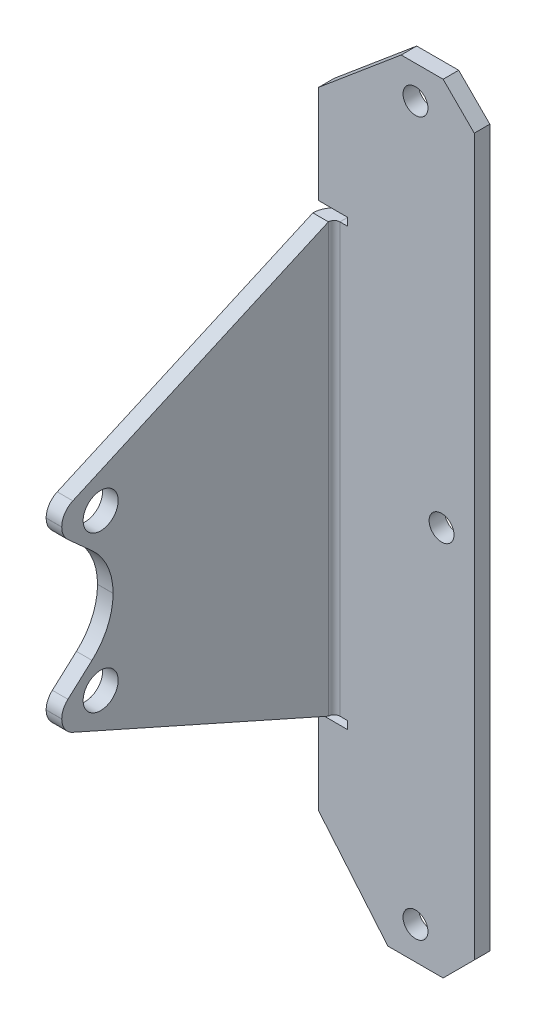
from build123d import *
from OCP.BRepFilletAPI import BRepFilletAPI_MakeChamfer

# Parameters (mm, degrees)
SKETCH1_W             = 100
SKETCH1_H             = 20
SKETCH1_R             = 1.6
BASE_FLANGE2_DEPTH    = 2
MITER_START           = 21.5
MITER_FLANGE1_DEPTH   = 57
MITER_FLANGE1_2_DEPTH = 1
MITER_START_2         = 77.5
MITER_FLANGE1_3_DEPTH = 1
MITER_START_3         = 22.5
MITER_FLANGE1_4_DEPTH = 55
CUT_EXTRUDE2_DEPTH    = 108.466273779
FILLET1_R             = 2.4
FILLET2_R             = 8.2
SKETCH8_R             = 2.25
CUT_EXTRUDE1_DEPTH    = 108.466273779
CHAMFER1_SIZE         = 8.9
CHAMFER1_SIZE2        = 10.606606974
CHAMFER2_SIZE         = 4


# Read off the part's stored shape, not the designer's step: Miter Flange1
# Sheet-metal steps are written as plain solids
with BuildPart() as part:
    # Sketch1 → Base-Flange2 (new body)
    with BuildSketch(Plane(origin=(0, 0, 0), x_dir=(0, 1, 0), z_dir=(0, 0, 1))):
        with Locations((50, 10)):
            Rectangle(SKETCH1_W, SKETCH1_H)
        with Locations(Location((50, 4.2, 0), (0, 0, 270))):
            Circle(SKETCH1_R, mode=Mode.SUBTRACT)
        with Locations(Location((4.2, 7.55, 0), (0, 0, 270))):
            Circle(SKETCH1_R, mode=Mode.SUBTRACT)
        with Locations(Location((95.8, 7.55, 0), (0, 0, 270))):
            Circle(SKETCH1_R, mode=Mode.SUBTRACT)
    extrude(amount=-BASE_FLANGE2_DEPTH)

    # Miter Flange1 outline → Miter Flange1 (cut)
    with BuildSketch(Plane(origin=(0, 0, 0), x_dir=(1, 0, 0), z_dir=(0, 1, 0)).offset(MITER_START)):
        with BuildLine():
            Line((-20, 0), (-19.899002398, 0))
            ThreePointArc((-19.899002398, 0), (-18.917667209, 1.443395312), (-17.2634, 2))
            Line((-17.2634, 2), (-20, 2))
            Line((-20, 2), (-20, 0))
        make_face()
    extrude(amount=MITER_FLANGE1_DEPTH, mode=Mode.SUBTRACT)

    # Miter Flange1 2 outline → Miter Flange1 2 (cut)
    with BuildSketch(Plane(origin=(0, 0, 0), x_dir=(1, 0, 0), z_dir=(0, 1, 0)).offset(MITER_START)):
        with BuildLine():
            ThreePointArc((-17.2634, 2), (-18.917667209, 1.443395312), (-19.899002398, 0))
            Line((-19.899002398, 0), (-16.2634, 0))
            Line((-16.2634, 0), (-16.2634, 2))
            Line((-16.2634, 2), (-17.2634, 2))
        make_face()
    extrude(amount=MITER_FLANGE1_2_DEPTH, mode=Mode.SUBTRACT)

    # Miter Flange1 3 outline → Miter Flange1 3 (cut)
    with BuildSketch(Plane(origin=(0, 0, 0), x_dir=(1, 0, 0), z_dir=(0, 1, 0)).offset(MITER_START_2)):
        with BuildLine():
            ThreePointArc((-17.2634, 2), (-18.917667209, 1.443395312), (-19.899002398, 0))
            Line((-19.899002398, 0), (-16.2634, 0))
            Line((-16.2634, 0), (-16.2634, 2))
            Line((-16.2634, 2), (-17.2634, 2))
        make_face()
    extrude(amount=MITER_FLANGE1_3_DEPTH, mode=Mode.SUBTRACT)

    # Miter Flange1 4 outline → Miter Flange1 4 (add)
    with BuildSketch(Plane(origin=(0, 0, 0), x_dir=(1, 0, 0), z_dir=(0, 1, 0)).offset(MITER_START_3)):
        with BuildLine():
            Line((-20, -0.7366), (-20, -35))
            Line((-20, -35), (-18, -35))
            Line((-18, -35), (-18, -0.7366))
            ThreePointArc((-18, -0.7366), (-17.784254855, -0.215745145), (-17.2634, 0))
            Line((-17.2634, 0), (-19.899002398, 0))
            ThreePointArc((-19.899002398, 0), (-19.974633029, -0.364854094), (-20, -0.7366))
        make_face()
    extrude(amount=MITER_FLANGE1_4_DEPTH)

    # Sketch9 → Cut-Extrude2 (cut, through all)
    with BuildSketch(Plane.YZ.offset(-18)):
        Polygon((22.5, 0.7366), (37.755048536, 35), (22.5, 35), align=None)
        Polygon((62.244951464, 35), (77.5, 35), (77.5, 0.7366), align=None)
        Polygon((40.4, 35), (59.6, 35), (53.657333308, 28.4), (46.342666692, 28.4), align=None)
    extrude(amount=-CUT_EXTRUDE2_DEPTH, mode=Mode.SUBTRACT)

    # Fillet1
    fillet1_edges = [part.edges().sort_by_distance(p)[0] for p in [
        (-19, 40.4, 35),
        (-19, 59.6, 35),
        (-19, 37.755048536, 35),
        (-19, 62.244951464, 35),
    ]]
    fillet(fillet1_edges, radius=FILLET1_R)

    # Fillet2
    fillet2_edges = [part.edges().sort_by_distance(p)[0] for p in [
        (-19, 53.657333308, 28.4),
        (-19, 46.342666692, 28.4),
    ]]
    fillet(fillet2_edges, radius=FILLET2_R)

    # Sketch8 → Cut-Extrude1 (cut, through all)
    with BuildSketch(Plane.YZ.offset(-18)):
        with Locations(Location((40, 30, 0), (0, 0, 270))):
            Circle(SKETCH8_R)
        with Locations(Location((60, 30, 0), (0, 0, 270))):
            Circle(SKETCH8_R)
    extrude(amount=-CUT_EXTRUDE1_DEPTH, mode=Mode.SUBTRACT)

    # Chamfer1: one chamfer whose edges measure the first distance from different faces: ONE call of the kernel's chamfer builder (chamfer() names one face for all edges)
    chamfer1_edges_1 = [part.edges().sort_by_distance(p)[0] for p in [
        (-20, 0, -1),
    ]]
    chamfer1_side_1 = [part.faces().sort_by_distance(p)[0] for p in [
        (-10, 0, -1),
    ]]
    chamfer1_edges_2 = [part.edges().sort_by_distance(p)[0] for p in [
        (-20, 100, -1),
    ]]
    chamfer1_side_2 = [part.faces().sort_by_distance(p)[0] for p in [
        (-20, 89.25, -1),
    ]]
    chamfer1 = BRepFilletAPI_MakeChamfer(part.part.solid().wrapped)
    for e in chamfer1_edges_1:
        chamfer1.Add(CHAMFER1_SIZE, CHAMFER1_SIZE2, e.wrapped, chamfer1_side_1[0].wrapped)  # the first distance lies on this face
    for e in chamfer1_edges_2:
        chamfer1.Add(CHAMFER1_SIZE, CHAMFER1_SIZE2, e.wrapped, chamfer1_side_2[0].wrapped)  # the first distance lies on this face
    add(Compound.cast(chamfer1.Shape()), mode=Mode.REPLACE)

    # Chamfer2
    chamfer2_edges = [part.edges().sort_by_distance(p)[0] for p in [
        (0, 100, -1),
        (0, 0, -1),
    ]]
    chamfer(chamfer2_edges, length=CHAMFER2_SIZE)


solid = part.part
